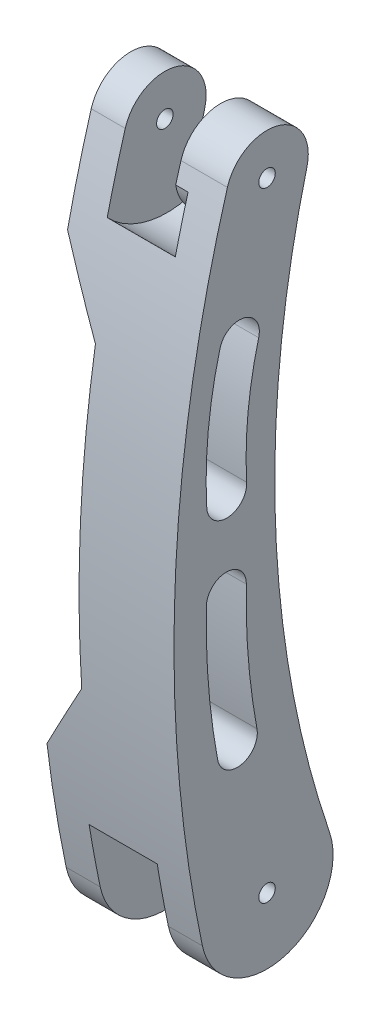
from build123d import *

# Parameters (mm, degrees)
SKETCH1_R               = 2
BOSS_EXTRUDE1_DEPTH     = 33
CUT_EXTRUDE1_DEPTH      = 13.5
CUT_EXTRUDE2_DEPTH      = 16.5
SKETCH4_R               = 2
CUT_EXTRUDE3_DEPTH      = 5
CUT_EXTRUDE4_DEPTH      = 3
CUT_EXTRUDE5_DEPTH      = 165.915343567
CUT_EXTRUDE5_DEPTH_BACK = 165.915343567


with BuildPart() as part:
    # Sketch1 → Boss-Extrude1 (new body)
    with BuildSketch(Plane(origin=(0, 0, 0), x_dir=(0, 0, -1), z_dir=(1, 0, 0))):
        with BuildLine():
            ThreePointArc((-15.655767357, -3.301052632), (4.23010614, -15.430690265), (15.150532835, 5.14406015))
            ThreePointArc((15.150532835, 5.14406015), (2.061435357, 75.934610115), (9.687600322, 147.52))
            ThreePointArc((9.687600322, 147.52), (2.648142621, 159.642994382), (-9.595470315, 152.815483871))
            ThreePointArc((-9.595470315, 152.815483871), (-22.299585285, 75.132749894), (-15.655767357, -3.301052632))
        make_face()
        with Locations((0, 150)):
            Circle(SKETCH1_R, mode=Mode.SUBTRACT)
        Circle(SKETCH1_R, mode=Mode.SUBTRACT)
        with BuildLine():
            ThreePointArc((-14.700960157, 67.490694293), (-14.190081456, 50.614025637), (-11.957538802, 33.87787628))
            ThreePointArc((-11.957538802, 33.87787628), (-6.31290903, 30.002830364), (-2.437863115, 35.647460135))
            ThreePointArc((-2.437863115, 35.647460135), (-4.539422028, 51.401696137), (-5.02032737, 67.288207141))
            ThreePointArc((-5.02032737, 67.288207141), (-9.759400188, 72.229767111), (-14.700960157, 67.490694293))
        make_face(mode=Mode.SUBTRACT)
        with BuildLine():
            ThreePointArc((-11.385602752, 119.936780983), (-14.234457233, 104.132844587), (-14.596733297, 88.078277215))
            ThreePointArc((-14.596733297, 88.078277215), (-9.495024373, 83.51205425), (-4.928801408, 88.613763173))
            ThreePointArc((-4.928801408, 88.613763173), (-4.600520511, 103.161806251), (-2.018996092, 117.482736997))
            ThreePointArc((-2.018996092, 117.482736997), (-5.475277429, 123.39306232), (-11.385602752, 119.936780983))
        make_face(mode=Mode.SUBTRACT)
    extrude(amount=BOSS_EXTRUDE1_DEPTH)

    # Sketch2 → Cut-Extrude1 (cut)
    with BuildSketch(Plane.ZY.offset(-8.25)):
        with BuildLine():
            ThreePointArc((9.595470315, 152.815483871), (-2.648142621, 159.642994382), (-9.687600322, 147.52))
            ThreePointArc((-9.687600322, 147.52), (-7.708879323, 139.200832276), (-6.015831394, 130.818858933))
            ThreePointArc((-6.015831394, 130.818858933), (4.739938392, 130.76185143), (13.969820877, 136.284450716))
            ThreePointArc((13.969820877, 136.284450716), (11.893087446, 144.579191805), (9.595470315, 152.815483871))
        make_face()
    extrude(amount=-CUT_EXTRUDE1_DEPTH, mode=Mode.SUBTRACT)

    # Sketch3 → Cut-Extrude2 (cut)
    with BuildSketch(Plane.ZY.offset(-8.25)):
        with BuildLine():
            ThreePointArc((15.655767357, -3.301052632), (17.088067317, 3.900124881), (18.354773789, 11.132268095))
            ThreePointArc((18.354773789, 11.132268095), (5.206126075, 21.379057379), (-11.138896907, 18.10432822))
            ThreePointArc((-11.138896907, 18.10432822), (-13.056783115, 11.596976369), (-15.150532835, 5.14406015))
            ThreePointArc((-15.150532835, 5.14406015), (-4.23010614, -15.430690265), (15.655767357, -3.301052632))
        make_face()
    extrude(amount=-CUT_EXTRUDE2_DEPTH, mode=Mode.SUBTRACT)

    # Sketch4 → Cut-Extrude3 (cut)
    with BuildSketch(Plane.ZY):
        with BuildLine():
            Line((5.508484382, 3.419742698), (6.214100211, 16.883694767))
            ThreePointArc((6.214100211, 16.883694767), (4.158233816, 19.562952015), (1.190354311, 17.951524922))
            Line((1.190354311, 17.951524922), (-3.641316221, 5.364592854))
            ThreePointArc((-3.641316221, 5.364592854), (-3.710000961, 5.241267271), (-3.810417562, 5.14205387))
            ThreePointArc((-3.810417562, 5.14205387), (-1.330634821, -6.260144645), (5.572451385, 3.147663508))
            ThreePointArc((5.572451385, 3.147663508), (5.521069981, 3.279142571), (5.508484382, 3.419742698))
        make_face()
        Circle(SKETCH4_R, mode=Mode.SUBTRACT)
    extrude(amount=-CUT_EXTRUDE3_DEPTH, mode=Mode.SUBTRACT)

    # Sketch6 → Cut-Extrude4 (cut)
    with BuildSketch(Plane.ZY.offset(-21.75)):
        with BuildLine():
            ThreePointArc((-6.015831394, 130.818858933), (-7.236301399, 137.004278392), (-8.612359207, 143.156954706))
            ThreePointArc((-8.612359207, 143.156954706), (2.826774034, 139.369414477), (10.873796416, 148.338509252))
            ThreePointArc((10.873796416, 148.338509252), (12.480414372, 142.326532571), (13.969820877, 136.284450716))
            ThreePointArc((13.969820877, 136.284450716), (4.739938392, 130.76185143), (-6.015831394, 130.818858933))
        make_face()
    extrude(amount=-CUT_EXTRUDE4_DEPTH, mode=Mode.SUBTRACT)

    # Sketch8 → Cut-Extrude5 (cut, two sides: drawn at the far end of the back side and taken through both)
    with BuildSketch(Plane.XY.offset(-CUT_EXTRUDE5_DEPTH_BACK)):
        Polygon((0, 130.284450716), (0, 25), (10, 42.320508076), (10, 112.963942641), align=None)
    extrude(amount=CUT_EXTRUDE5_DEPTH + CUT_EXTRUDE5_DEPTH_BACK, mode=Mode.SUBTRACT)


solid = part.part
